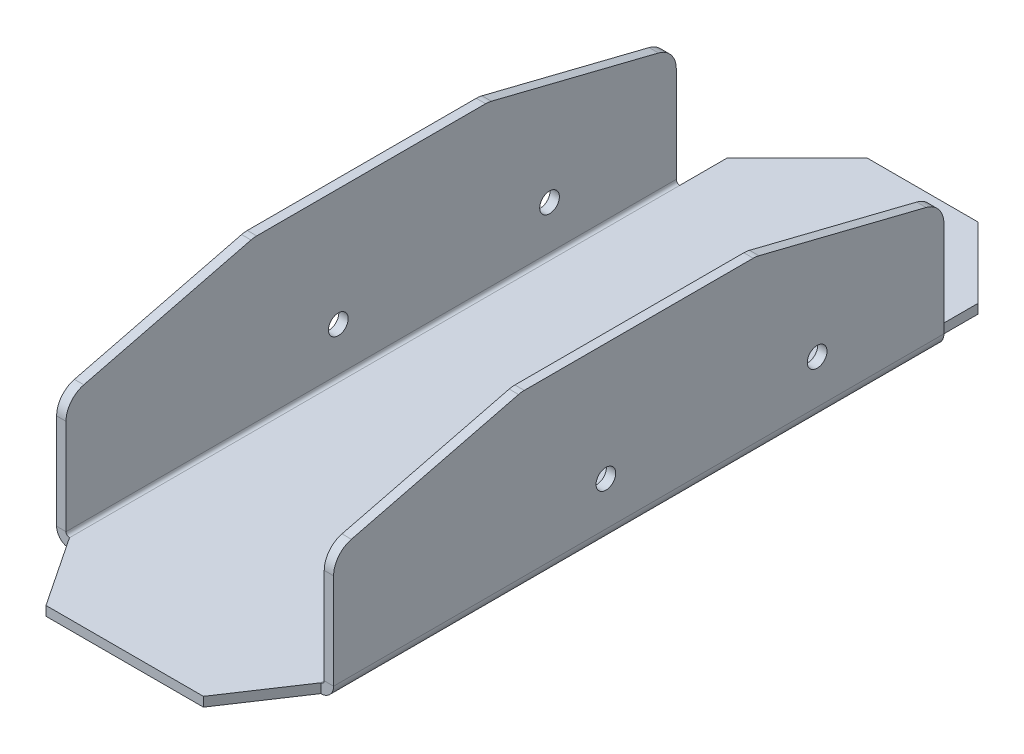
from build123d import *
from OCP.BRepFilletAPI import BRepFilletAPI_MakeChamfer

# Parameters (mm, degrees)
SM_BASE_FLANGE_1_DEPTH = 130
SKETCH_6_R             = 2.1
CUT_EXTRUDE_1_DEPTH    = 147.989795564
PATTERN_LINEAR_1_COUNT = 2
PATTERN_LINEAR_1_PITCH = 45
CHAMFER_1_SIZE         = 10
CHAMFER_1_SIZE2        = 40
CHAMFER_2_SIZE         = 40
CHAMFER_2_SIZE2        = 10
FILLET_1_R             = 5
SKETCH_9_W             = 53.5268
SKETCH_9_H             = 2
EXTRUDE_1_DEPTH        = 15
CHAMFER_5_SIZE         = 10
CHAMFER_5_SIZE_2       = 15
SKETCH_11_W            = 53.5268
SKETCH_11_H            = 2
EXTRUDE_2_DEPTH        = 25
CHAMFER_6_SIZE         = 15


# Read off the part's stored shape, not the designer's step: 基材-凸緣1
with BuildPart() as part:
    # 基材-凸緣1 outline → 基材-凸緣1 (new body)
    with BuildSketch(Plane.XY):
        with BuildLine():
            Line((29.5, 0.7366), (29.5, 35))
            Line((29.5, 35), (27.5, 35))
            Line((27.5, 35), (27.5, 0.7366))
            ThreePointArc((27.5, 0.7366), (27.284254855, 0.215745145), (26.7634, 0))
            Line((26.7634, 0), (-26.7634, 0))
            ThreePointArc((-26.7634, 0), (-27.284254855, 0.215745145), (-27.5, 0.7366))
            Line((-27.5, 0.7366), (-27.5, 35))
            Line((-27.5, 35), (-29.5, 35))
            Line((-29.5, 35), (-29.5, 0.7366))
            ThreePointArc((-29.5, 0.7366), (-28.698468417, -1.198468417), (-26.7634, -2))
            Line((-26.7634, -2), (26.7634, -2))
            ThreePointArc((26.7634, -2), (28.698468417, -1.198468417), (29.5, 0.7366))
        make_face()
    extrude(amount=SM_BASE_FLANGE_1_DEPTH)

    # 草圖6 → 除料-伸長1 (cut, through all)
    with BuildSketch(Plane.ZY.offset(29.5)):
        with Locations((72, 10)):
            Circle(SKETCH_6_R)
    cut_extrude_1 = extrude(amount=-CUT_EXTRUDE_1_DEPTH, mode=Mode.SUBTRACT)

    # 直線複製排列1: 除料-伸長1 ×2
    with Locations(*[(0, 0, -i * PATTERN_LINEAR_1_PITCH) for i in range(1, PATTERN_LINEAR_1_COUNT)]):
        add(cut_extrude_1, mode=Mode.SUBTRACT)

    # 導角1
    chamfer_1_edges = [part.edges().sort_by_distance(p)[0] for p in [
        (-28.5, 35, 130),
        (28.5, 35, 130),
    ]]
    chamfer_1_side = [part.faces().sort_by_distance(p)[0] for p in [
        (0, -1.303580586, 130),
    ]]
    chamfer(chamfer_1_edges, length=CHAMFER_1_SIZE, length2=CHAMFER_1_SIZE2, reference=chamfer_1_side[0])

    # 導角2: one chamfer whose edges measure the first distance from different faces: ONE call of the kernel's chamfer builder (chamfer() names one face for all edges)
    chamfer_2_edges_1 = [part.edges().sort_by_distance(p)[0] for p in [
        (-28.5, 35, 0),
    ]]
    chamfer_2_side_1 = [part.faces().sort_by_distance(p)[0] for p in [
        (-28.5, 35, 45),
    ]]
    chamfer_2_edges_2 = [part.edges().sort_by_distance(p)[0] for p in [
        (28.5, 35, 0),
    ]]
    chamfer_2_side_2 = [part.faces().sort_by_distance(p)[0] for p in [
        (28.5, 35, 45),
    ]]
    chamfer_2 = BRepFilletAPI_MakeChamfer(part.part.solid().wrapped)
    for e in chamfer_2_edges_1:
        chamfer_2.Add(CHAMFER_2_SIZE, CHAMFER_2_SIZE2, e.wrapped, chamfer_2_side_1[0].wrapped)  # the first distance lies on this face
    for e in chamfer_2_edges_2:
        chamfer_2.Add(CHAMFER_2_SIZE, CHAMFER_2_SIZE2, e.wrapped, chamfer_2_side_2[0].wrapped)  # the first distance lies on this face
    add(Compound.cast(chamfer_2.Shape()), mode=Mode.REPLACE)

    # 圓角1
    fillet_1_edges = [part.edges().sort_by_distance(p)[0] for p in [
        (28.5, 35, 90),
        (28.5, 25, 130),
        (-28.5, 35, 90),
        (-28.5, 25, 130),
        (-28.5, 25, 0),
        (-28.5, 35, 40),
        (28.5, 25, 0),
        (28.5, 35, 40),
    ]]
    fillet(fillet_1_edges, radius=FILLET_1_R)

    # 草圖9 → 填料-伸長1 (add)
    with BuildSketch(Plane.XY.offset(130)):
        with Locations((0, -1)):
            Rectangle(SKETCH_9_W, SKETCH_9_H)
    extrude(amount=EXTRUDE_1_DEPTH)

    # 導角5
    chamfer_5_edges_1 = [part.edges().sort_by_distance(p)[0] for p in [
        (-26.7634, -1, 145),
    ]]
    chamfer_5_side_1 = [part.faces().sort_by_distance(p)[0] for p in [
        (-26.5634, -1, 145),
    ]]
    chamfer_5_edges_2 = [part.edges().sort_by_distance(p)[0] for p in [
        (26.7634, -1, 145),
    ]]
    chamfer_5_side_2 = [part.faces().sort_by_distance(p)[0] for p in [
        (26.7634, -1, 144.8),
    ]]
    chamfer_5 = BRepFilletAPI_MakeChamfer(part.part.solid().wrapped)
    for e in chamfer_5_edges_1:
        chamfer_5.Add(CHAMFER_5_SIZE - 0.0001, CHAMFER_5_SIZE_2 - 0.0001, e.wrapped, chamfer_5_side_1[0].wrapped)
    for e in chamfer_5_edges_2:
        chamfer_5.Add(CHAMFER_5_SIZE_2 - 0.0001, CHAMFER_5_SIZE - 0.0001, e.wrapped, chamfer_5_side_2[0].wrapped)
    add(Compound.cast(chamfer_5.Shape()), mode=Mode.REPLACE)  # a hair under: the kernel refuses the full size

    # 草圖11 → 填料-伸長2 (add)
    with BuildSketch(Plane(origin=(0, 0, 0), x_dir=(-1, 0, 0), z_dir=(0, 0, -1))):
        with Locations((0, -1)):
            Rectangle(SKETCH_11_W, SKETCH_11_H)
    extrude(amount=EXTRUDE_2_DEPTH)

    # 導角6
    chamfer_6_edges = [part.edges().sort_by_distance(p)[0] for p in [
        (26.7634, -1, -25),
        (-26.7634, -1, -25),
    ]]
    chamfer(chamfer_6_edges, length=CHAMFER_6_SIZE)


solid = part.part
